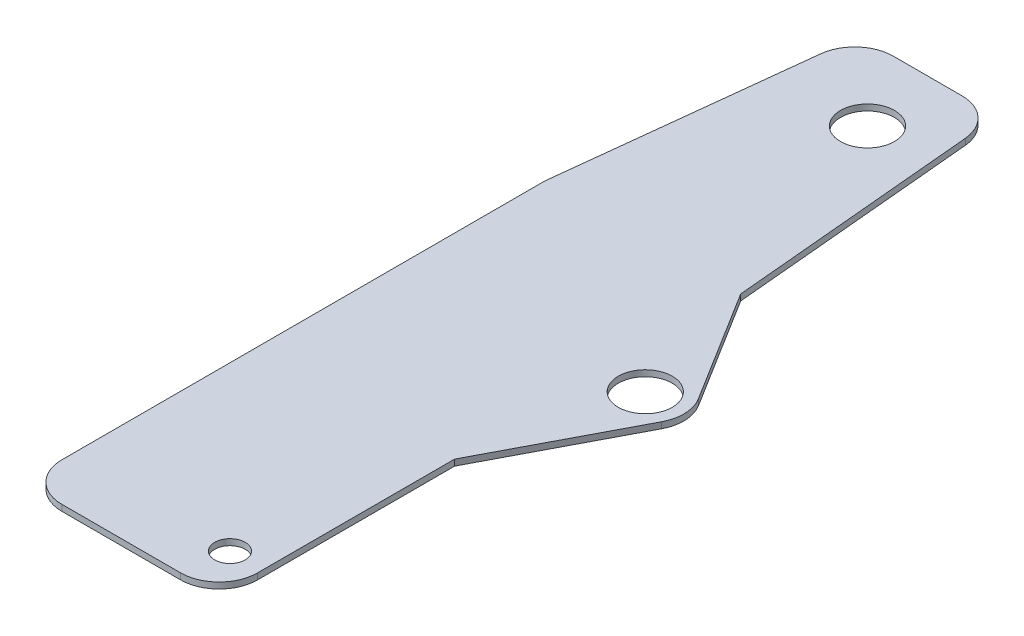
from build123d import *

# Parameters (mm, degrees)
SKETCH1_R           = 5.969
SKETCH1_R_2         = 3.960069723
SKETCH1_R_3         = 7
BOSS_EXTRUDE1_DEPTH = 1.5875
SKETCH4_W           = 66.272407177
SKETCH4_H           = 27.800260981
CUT_EXTRUDE2_DEPTH  = 20
SKETCH5_R           = 6.683690244
BOSS_EXTRUDE2_DEPTH = 1.5875
FILLET3_R           = 10
FILLET4_R           = 10
BOSS_EXTRUDE3_START = -1.5875
BOSS_EXTRUDE3_DEPTH = 1.5875
SKETCH7_R           = 7
CUT_EXTRUDE3_DEPTH  = 1.5875


with BuildPart() as part:
    # Sketch1 → Boss-Extrude1 (new body)
    with BuildSketch(Plane(origin=(0, 0, 0), x_dir=(1, 0, 0), z_dir=(0, 1, 0))):
        with BuildLine():
            Line((42.32729629, 228.6), (10.454309325, 228.6))
            Line((10.454309325, 228.6), (0, 135.362739137))
            Line((0, 135.362739137), (0, 0))
            Line((0, 0), (24.327009544, 0))
            Line((24.327009544, 0), (50.8, 0))
            Line((50.8, 0), (50.8, 64.87909603))
            Line((50.8, 64.87909603), (50.8, 87.423477361))
            Line((50.8, 87.423477361), (50.8, 98.200996728))
            ThreePointArc((50.8, 98.200996728), (50.4, 101.000996728), (50.8, 103.800996728))
            Line((50.8, 103.800996728), (50.8, 104.488200565))
            Line((50.8, 104.488200565), (50.8, 120.619222808))
            Line((50.8, 120.619222808), (50.8, 135.362739137))
            Line((50.8, 135.362739137), (42.32729629, 228.6))
        make_face()
        with Locations((24.327009544, 25.509186042)):
            Circle(SKETCH1_R, mode=Mode.SUBTRACT)
        with Locations((42.32729629, 11.29561028)):
            Circle(SKETCH1_R_2, mode=Mode.SUBTRACT)
        with Locations((29.504213454, 189.557234372)):
            Circle(SKETCH1_R_3, mode=Mode.SUBTRACT)
    extrude(amount=BOSS_EXTRUDE1_DEPTH)

    # Sketch4 → Cut-Extrude2 (cut)
    with BuildSketch(Plane(origin=(0, 0, -228.6), x_dir=(-1, 0, 0), z_dir=(0, 0, -1))):
        with Locations((-28.174690156, -1.980940155)):
            Rectangle(SKETCH4_W, SKETCH4_H)
    extrude(amount=-CUT_EXTRUDE2_DEPTH, mode=Mode.SUBTRACT)

    # Sketch5 → Boss-Extrude2 (add)
    with BuildSketch(Plane.XZ):
        with Locations((24.327009544, -25.509186042)):
            Circle(SKETCH5_R)
    extrude(amount=-BOSS_EXTRUDE2_DEPTH)

    # Fillet3
    fillet3_edges = [part.edges().sort_by_distance(p)[0] for p in [
        (44.144746445, 0.79375, -208.6),
    ]]
    fillet(fillet3_edges, radius=FILLET3_R)

    # Fillet4
    fillet4_edges = [part.edges().sort_by_distance(p)[0] for p in [
        (50.8, 0.79375, 0),
        (0, 0.79375, 0),
        (8.211791854, 0.79375, -208.6),
    ]]
    fillet(fillet4_edges, radius=FILLET4_R)

    # Sketch6 → Boss-Extrude3 (add)
    with BuildSketch(Plane(origin=(0, 1.5875, 0), x_dir=(1, 0, 0), z_dir=(0, 1, 0)).offset(BOSS_EXTRUDE3_START)):
        with BuildLine():
            Line((50.8, 135.362739137), (50.8, 103.800996728))
            ThreePointArc((50.8, 103.800996728), (50.4, 101.000996728), (50.8, 98.200996728))
            Line((50.8, 98.200996728), (50.8, 61.124243317))
            Line((50.8, 61.124243317), (69.258211507, 96.360728536))
            ThreePointArc((69.258211507, 96.360728536), (70.393157133, 101.370875786), (68.890940865, 106.283413148))
            Line((68.890940865, 106.283413148), (50.8, 135.362739137))
        make_face()
    extrude(amount=BOSS_EXTRUDE3_DEPTH)

    # Sketch7 → Cut-Extrude3 (cut)
    with BuildSketch(Plane(origin=(0, 1.5875, 0), x_dir=(1, 0, 0), z_dir=(0, 1, 0))):
        with Locations((60.4, 101.000996728)):
            Circle(SKETCH7_R)
    extrude(amount=-CUT_EXTRUDE3_DEPTH, mode=Mode.SUBTRACT)


solid = part.part
